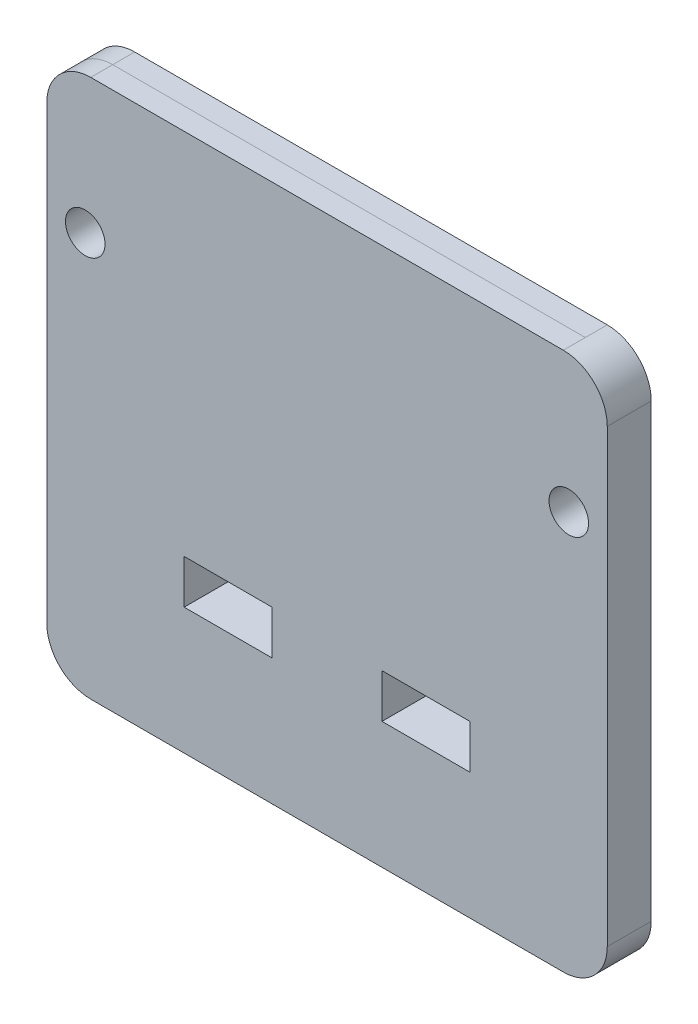
from build123d import *

# Parameters (mm, degrees)
SKETCH1_R                      = 11.422
BOSS_EXTRUDE1_DEPTH            = 25.4
SKETCH2_W                      = 50.8
SKETCH2_H                      = 25.4
FOAM_INSERT_CUT_THROUGHS_DEPTH = 25.4


with BuildPart() as part:
    # Sketch1 → Boss-Extrude1 (new body)
    with BuildSketch(Plane.XY):
        with BuildLine():
            Line((-136.525, -155.575), (136.525, -155.575))
            ThreePointArc((136.525, -155.575), (154.485512242, -148.135512242), (161.925, -130.175))
            Line((161.925, -130.175), (161.925, 130.175))
            ThreePointArc((161.925, 130.175), (154.485512242, 148.135512242), (136.525, 155.575))
            Line((136.525, 155.575), (-136.525, 155.575))
            ThreePointArc((-136.525, 155.575), (-154.485512242, 148.135512242), (-161.925, 130.175))
            Line((-161.925, 130.175), (-161.925, -130.175))
            ThreePointArc((-161.925, -130.175), (-154.485512242, -148.135512242), (-136.525, -155.575))
        make_face()
        with Locations((-139.7, 76.2)):
            Circle(SKETCH1_R, mode=Mode.SUBTRACT)
        with Locations((139.7, 76.2)):
            Circle(SKETCH1_R, mode=Mode.SUBTRACT)
    extrude(amount=BOSS_EXTRUDE1_DEPTH)

    # Sketch2 → Foam Insert Cut-Throughs (cut)
    with BuildSketch(Plane(origin=(0, 0, 0), x_dir=(-1, 0, 0), z_dir=(0, 0, -1))):
        with Locations((-57.15, -69.85)):
            Rectangle(SKETCH2_W, SKETCH2_H)
        with Locations((57.15, -69.85)):
            Rectangle(SKETCH2_W, SKETCH2_H)
    extrude(amount=-FOAM_INSERT_CUT_THROUGHS_DEPTH, mode=Mode.SUBTRACT)


solid = part.part
